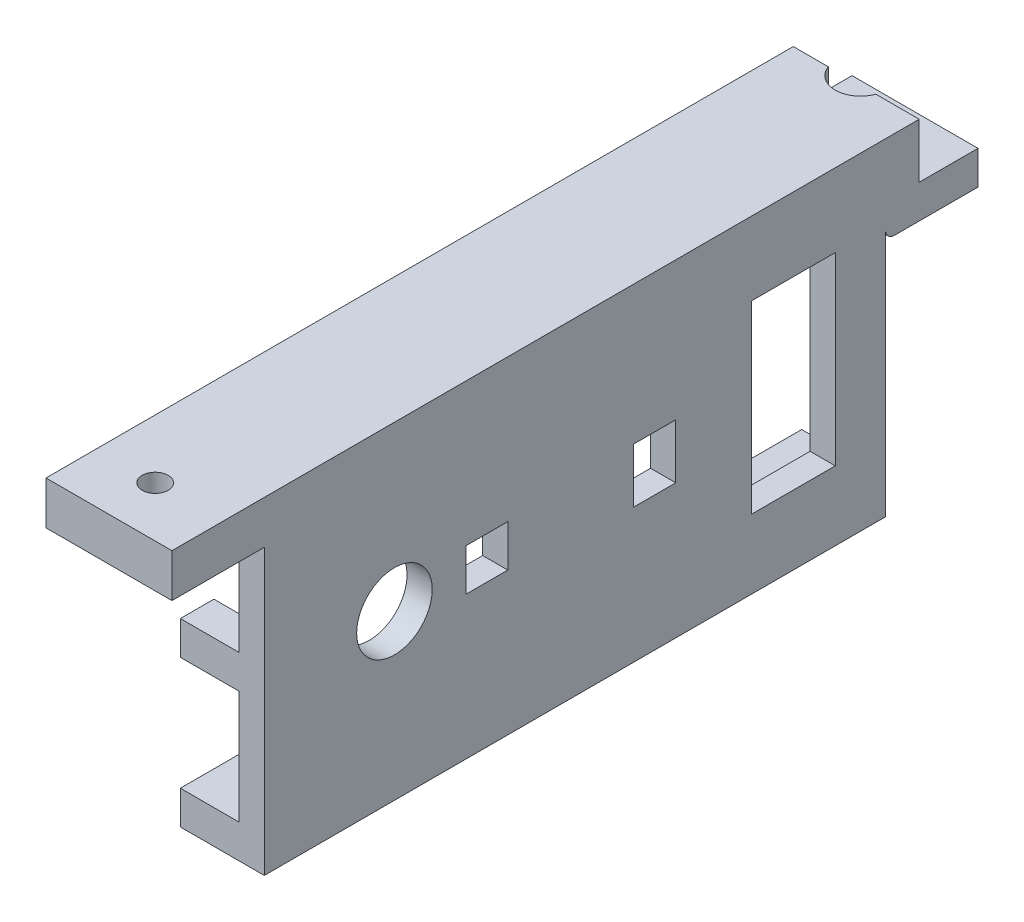
from build123d import *

# Parameters (mm, degrees)
EXTRUDE_START       = -12
EXTRUDE_1_DEPTH     = 12
SKETCH_2_R          = 4.5
EXTRUDE_2_DEPTH     = 3
SKETCH_3_W          = 74
SKETCH_3_H          = 4
SKETCH_3_W_2        = 4
EXTRUDE_3_DEPTH     = 7
SKETCH_4_W          = 5
SKETCH_4_H          = 6.5
SKETCH_4_H_2        = 5
SKETCH_4_W_2        = 10
SKETCH_4_H_3        = 22
CUT_EXTRUDE_1_DEPTH = 7
SKETCH_5_R          = 1.55
CUT_EXTRUDE_2_DEPTH = 7
SKETCH_6_R          = 3
CUT_EXTRUDE_4_DEPTH = 7
SKETCH_8_W          = 123.006467786
SKETCH_8_H          = 80.173858468
CUT_EXTRUDE_6_DEPTH = 15
SKETCH_11_R         = 1.55
EXTRUDE_5_DEPTH     = 5.15
CUT_EXTRUDE_8_REACH = 107.579
SKETCH_12_W         = 15.113452747
SKETCH_12_H         = 5.35


# Read off the part's stored shape, not the designer's step: 填料-伸長1
with BuildPart() as part:
    # 填料-伸長1 outline → 填料-伸長1 (new body)
    with BuildSketch(Plane.ZY.offset(65.537274581).offset(EXTRUDE_START)):
        with BuildLine():
            Line((41, 0.007142857), (41, 6.507142857))
            Line((41, 6.507142857), (-41, 6.507142857))
            Line((-41, 6.507142857), (-41, 0.007142857))
            Line((-41, 0.007142857), (-48, 0.007142857))
            Line((-48, 0.007142857), (-48, -3.992857143))
            Line((-48, -3.992857143), (-38, -3.992857143))
            ThreePointArc((-38, -3.992857143), (-37.292893219, -3.699963924), (-37, -2.992857143))
            Line((-37, -2.992857143), (-37, 2.507142857))
            Line((-37, 2.507142857), (37, 2.507142857))
            Line((37, 2.507142857), (37, -2.992857143))
            ThreePointArc((37, -2.992857143), (37.292893219, -3.699963924), (38, -3.992857143))
            Line((38, -3.992857143), (48, -3.992857143))
            Line((48, -3.992857143), (48, 0.007142857))
            Line((48, 0.007142857), (41, 0.007142857))
        make_face()
    extrude(amount=EXTRUDE_1_DEPTH)

    # 草圖2 → 填料-伸長2 (add)
    # profile 1 of 2: a face of its own
    with BuildSketch(Plane.ZY.offset(65.537274581)):
        Polygon((37, 2.507142857), (-37, 2.507142857), (-37, -2.992857143), (-37, -32.492857143), (37, -32.492857143), (37, -2.992857143), align=None)
        with Locations((21.5, -12.992857143)):
            Circle(SKETCH_2_R, mode=Mode.SUBTRACT)
    # profile 2 of 2: a face of its own
    with BuildSketch(Plane.ZY.offset(65.537274581)):
        with BuildLine():
            Line((41, 0.007142857), (41, 6.507142857))
            Line((41, 6.507142857), (-41, 6.507142857))
            Line((-41, 6.507142857), (-41, 0.007142857))
            Line((-41, 0.007142857), (-48, 0.007142857))
            Line((-48, 0.007142857), (-48, -3.992857143))
            Line((-48, -3.992857143), (-38, -3.992857143))
            ThreePointArc((-38, -3.992857143), (-37.292893219, -3.699963924), (-37, -2.992857143))
            Line((-37, -2.992857143), (-37, 2.507142857))
            Line((-37, 2.507142857), (37, 2.507142857))
            Line((37, 2.507142857), (37, -2.992857143))
            ThreePointArc((37, -2.992857143), (37.292893219, -3.699963924), (38, -3.992857143))
            Line((38, -3.992857143), (48, -3.992857143))
            Line((48, -3.992857143), (48, 0.007142857))
            Line((48, 0.007142857), (41, 0.007142857))
        make_face()
    extrude(amount=EXTRUDE_2_DEPTH)

    # 草圖3 → 填料-伸長3 (add)
    with BuildSketch(Plane(origin=(-65.537274581, 0, 0), x_dir=(0, 0, -1), z_dir=(1, 0, 0))):
        with Locations((0, -30.492857143)):
            Rectangle(SKETCH_3_W, SKETCH_3_H)
        with Locations((-35, -12.992857143)):
            Rectangle(SKETCH_3_W_2, SKETCH_3_H)
    extrude(amount=EXTRUDE_3_DEPTH)

    # 草圖4 → 除料-伸長1 (cut)
    with BuildSketch(Plane.ZY.offset(68.537274581)):
        with Locations((-9.5, -13.242857143)):
            Rectangle(SKETCH_4_W, SKETCH_4_H)
        with Locations((10.5, -12.992857143)):
            Rectangle(SKETCH_4_W, SKETCH_4_H_2)
        with Locations((-26, -13.242857143)):
            Rectangle(SKETCH_4_W_2, SKETCH_4_H_3)
    extrude(amount=-CUT_EXTRUDE_1_DEPTH, mode=Mode.SUBTRACT)

    # 草圖5 → 除料-伸長2 (cut)
    with BuildSketch(Plane(origin=(0, 0.007142857, 0), x_dir=(1, 0, 0), z_dir=(0, 1, 0))):
        with Locations(Location((-60.537274581, -42, 0), (0, 0, 40.17776954))):
            Circle(SKETCH_5_R)
        with Locations(Location((-60.537274581, 42, 0), (0, 0, 220.17776954))):
            Circle(SKETCH_5_R)
    extrude(amount=-CUT_EXTRUDE_2_DEPTH, mode=Mode.SUBTRACT)

    # 草圖6 → 除料-伸長4 (cut)
    with BuildSketch(Plane(origin=(0, 0.007142857, 0), x_dir=(1, 0, 0), z_dir=(0, 1, 0))):
        with Locations((-60.537274581, -42)):
            Circle(SKETCH_6_R)
        with Locations((-60.537274581, 42)):
            Circle(SKETCH_6_R)
    extrude(amount=CUT_EXTRUDE_4_DEPTH, mode=Mode.SUBTRACT)

    # 鏡射2: part across plane


with BuildPart() as part_1:
    add(part.part)
    add(part.part.mirror(Plane(origin=(-53.537274581, 0, 0), x_dir=(0, 0, 1), z_dir=(1, 0, 0))))

    # 草圖8 → 除料-伸長6 (cut)
    with BuildSketch(Plane(origin=(-53.537274581, 0, 0), x_dir=(0, 0, -1), z_dir=(1, 0, 0))):
        with Locations((-0.366090678, -13.819923092)):
            Rectangle(SKETCH_8_W, SKETCH_8_H)
    extrude(amount=-CUT_EXTRUDE_6_DEPTH, mode=Mode.SUBTRACT)

    # 草圖11 → 填料-伸長5 (add)
    with BuildSketch(Plane(origin=(0, 1.357142857, 0), x_dir=(-1, 0, 0), z_dir=(0, -1, 0))):
        with BuildLine():
            Line((53.537274581, -48), (53.537274581, -41))
            Line((53.537274581, -41), (49.365701705, -41))
            ThreePointArc((49.365701705, -41), (46.537274581, -39), (43.708847456, -41))
            Line((43.708847456, -41), (38.537274581, -41))
            Line((38.537274581, -41), (38.537274581, -48))
            Line((38.537274581, -48), (53.537274581, -48))
        make_face()
        with Locations(Location((46.537274581, -42, 0), (0, 0, 270))):
            Circle(SKETCH_11_R, mode=Mode.SUBTRACT)
    extrude(amount=-EXTRUDE_5_DEPTH)

    # 草圖12 → 除料-伸長8 (cut, up to next)
    with BuildSketch(Plane.XY.offset(37), mode=Mode.PRIVATE) as cut_extrude_8_sk1:
        with Locations((-46.094000955, -1.317857143)):
            Rectangle(SKETCH_12_W, SKETCH_12_H)
    cut_extrude_8_tool1 = extrude(cut_extrude_8_sk1.sketch, amount=CUT_EXTRUDE_8_REACH, mode=Mode.PRIVATE) & part_1.part
    add(cut_extrude_8_tool1.solids().sort_by_distance((-46.094001, -1.317857, 37))[0], mode=Mode.SUBTRACT)


solid = part_1.part
